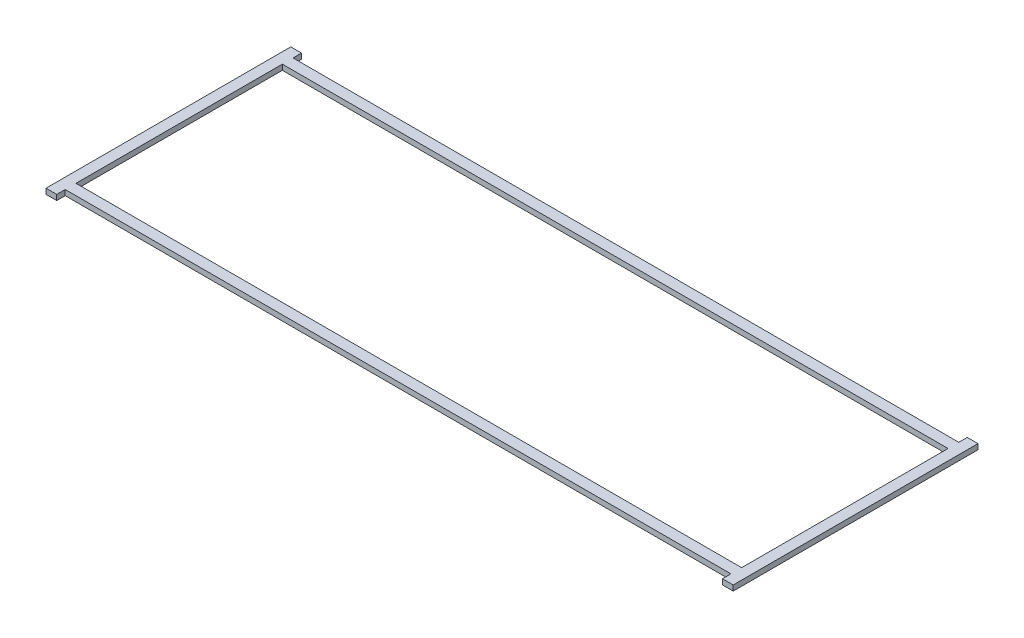
from build123d import *

# Parameters (mm, degrees)
SKETCH1_W           = 393.7
SKETCH1_H           = 122.0597
BOSS_EXTRUDE1_DEPTH = 3.175


with BuildPart() as part:
    # Sketch1 → Boss-Extrude1 (new body)
    with BuildSketch(Plane(origin=(0, 0, 0), x_dir=(1, 0, 0), z_dir=(0, 1, 0))):
        Polygon((196.85, 72.39), (203.2, 72.39), (203.2, -72.39), (196.85, -72.39), (196.85, -67.37985), (-196.85, -67.37985), (-196.85, -72.39), (-203.2, -72.39), (-203.2, 72.39), (-196.85, 72.39), (-196.85, 67.37985), (196.85, 67.37985), align=None)
        Rectangle(SKETCH1_W, SKETCH1_H, mode=Mode.SUBTRACT)
    extrude(amount=BOSS_EXTRUDE1_DEPTH)


solid = part.part
